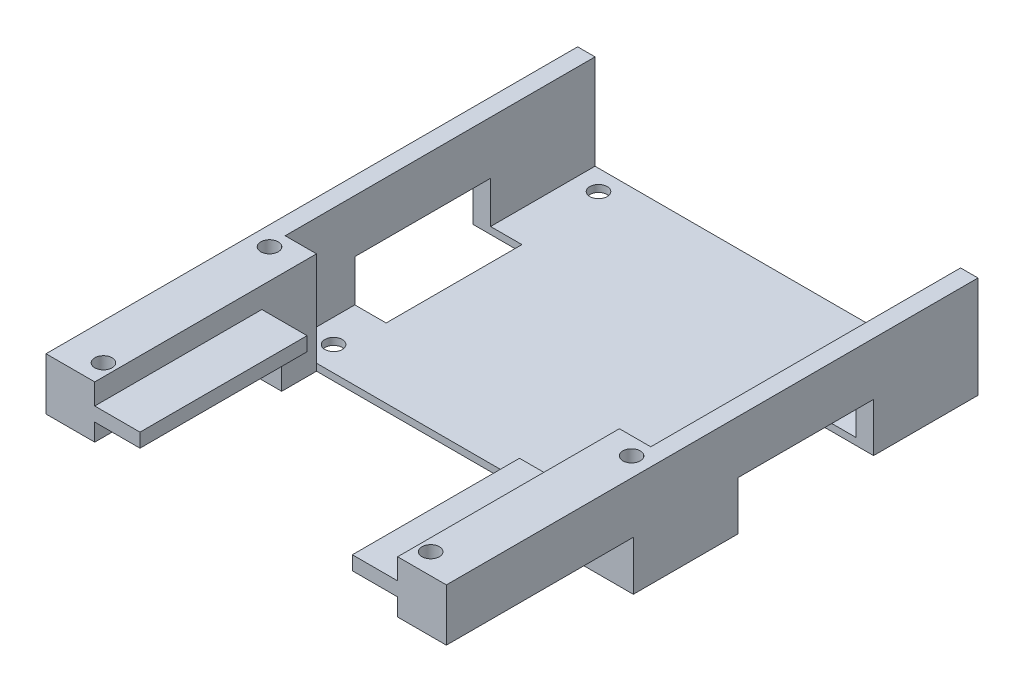
from build123d import *

# Parameters (mm, degrees)
SKETCH1_W                  = 52.5
SKETCH1_H                  = 44.5
BOSS_EXTRUDE1_DEPTH        = 1
BOSS_EXTRUDE2_DEPTH        = 14.6
F_2_5_2_5_DIAMETER_HOLE1_D = 2.5
SKETCH6_W                  = 6.5
SKETCH6_H                  = 2
BOSS_EXTRUDE3_DEPTH        = 24
SKETCH6_4_W                = 7
SKETCH6_4_H                = 7.1
CUT_EXTRUDE1_DEPTH         = 26.85
SKETCH8_W                  = 7
SKETCH8_H                  = 19.5
CUT_EXTRUDE2_DEPTH         = 7
CUT_EXTRUDE3_DEPTH         = 0.3


with BuildPart() as part:
    # Sketch1 → Boss-Extrude1 (new body)
    with BuildSketch(Plane(origin=(0, 0, 0), x_dir=(1, 0, 0), z_dir=(0, 1, 0))):
        with Locations((0, 54.1)):
            Rectangle(SKETCH1_W, SKETCH1_H)
    extrude(amount=BOSS_EXTRUDE1_DEPTH)

    # Sketch1<3> → Boss-Extrude2 (add)
    with BuildSketch(Plane(origin=(0, 0, 0), x_dir=(1, 0, 0), z_dir=(0, 1, 0))):
        Polygon((-26.25, 76.35), (-28.75, 76.35), (-28.75, 0), (-21.75, 0), (-21.75, 31.85), (-26.25, 31.85), align=None)
        Polygon((28.75, 76.35), (26.25, 76.35), (26.25, 31.85), (21.75, 31.85), (21.75, 0), (28.75, 0), align=None)
    extrude(amount=BOSS_EXTRUDE2_DEPTH)

    # Ø2.5 (2.5) Diameter Hole1 (through all)
    with Locations(Plane(origin=(0, 0, 0), x_dir=(-1, 0, 0), z_dir=(0, -1, 0))):
        with Locations((-22.85, 73.45), (22.85, 73.45), (26, 29.35), (22.85, 35.4), (-22.85, 35.4), (-26, 29.35), (-23.5, 3), (23.5, 3), (-30.25, 71.35), (30.25, 71.35)):
            Hole(F_2_5_2_5_DIAMETER_HOLE1_D / 2)

    # Sketch6 → Boss-Extrude3 (add)
    with BuildSketch(Plane.XY):
        with Locations((-18.5, 10.6)):
            Rectangle(SKETCH6_W, SKETCH6_H)
        with Locations((18.5, 10.6)):
            Rectangle(SKETCH6_W, SKETCH6_H)
    extrude(amount=-BOSS_EXTRUDE3_DEPTH)

    # Sketch6<4> → Cut-Extrude1 (cut)
    with BuildSketch(Plane.XY):
        with Locations((-25.25, 3.55)):
            Rectangle(SKETCH6_4_W, SKETCH6_4_H)
        with Locations((25.25, 3.55)):
            Rectangle(SKETCH6_4_W, SKETCH6_4_H)
    extrude(amount=-CUT_EXTRUDE1_DEPTH, mode=Mode.SUBTRACT)

    # Sketch8 → Cut-Extrude2 (cut)
    with BuildSketch(Plane.XZ):
        with Locations((-25.25, -51.6)):
            Rectangle(SKETCH8_W, SKETCH8_H)
        with Locations((25.25, -51.6)):
            Rectangle(SKETCH8_W, SKETCH8_H)
    extrude(amount=-CUT_EXTRUDE2_DEPTH, mode=Mode.SUBTRACT)

    # Sketch9 → Cut-Extrude3 (cut)
    with BuildSketch(Plane.XZ):
        Polygon((-3.689843301, -66.963585904), (-0.766939618, -56.191794443), (-9.599348257, -56.191794443), (4.207929605, -40.061796941), (3.001024061, -51.044637389), (10.995078197, -51.044637389), align=None)
    extrude(amount=-CUT_EXTRUDE3_DEPTH, mode=Mode.SUBTRACT)


solid = part.part
